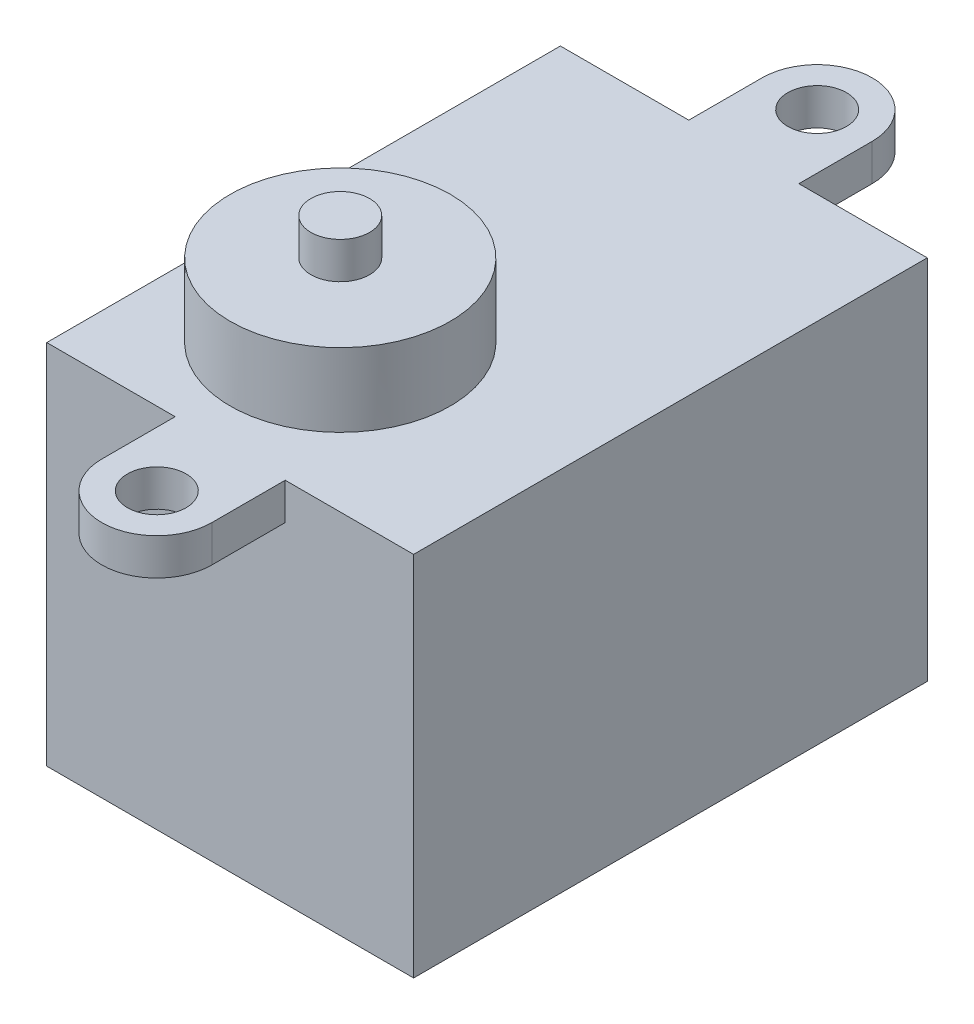
from build123d import *

# Parameters (mm, degrees)
SKETCH1_W           = 50
SKETCH1_H           = 70
BOSS_EXTRUDE1_DEPTH = 50
SKETCH2_R           = 15
BOSS_EXTRUDE2_DEPTH = 10
SKETCH3_R           = 4
BOSS_EXTRUDE3_DEPTH = 5
SHELL7_START        = 2
SHELL7_OUTLINE_W    = 46
SHELL7_OUTLINE_H    = 66
SHELL7_DEPTH        = 46
SHELL7_START_2      = 48
SHELL7_2_OUTLINE_R  = 13
SHELL7_2_DEPTH      = 10
SHELL7_START_3      = 58
SHELL7_3_OUTLINE_R  = 2
SHELL7_3_DEPTH      = 5
SKETCH4_R           = 4
BOSS_EXTRUDE4_DEPTH = 5


# Read off the part's stored shape, not the designer's step: Shell7
with BuildPart() as part:
    # Sketch1 → Boss-Extrude1 (new body)
    with BuildSketch(Plane(origin=(0, 0, 0), x_dir=(1, 0, 0), z_dir=(0, 1, 0))):
        with Locations((25, 35)):
            Rectangle(SKETCH1_W, SKETCH1_H)
    extrude(amount=BOSS_EXTRUDE1_DEPTH)

    # Sketch2 → Boss-Extrude2 (add)
    with BuildSketch(Plane(origin=(0, 50, 0), x_dir=(1, 0, 0), z_dir=(0, 1, 0))):
        with Locations(Location((20, 20, 0), (0, 0, 90))):
            Circle(SKETCH2_R)
    extrude(amount=BOSS_EXTRUDE2_DEPTH)

    # Sketch3 → Boss-Extrude3 (add)
    with BuildSketch(Plane(origin=(0, 60, 0), x_dir=(1, 0, 0), z_dir=(0, 1, 0))):
        with Locations(Location((20, 20, 0), (0, 0, 270))):
            Circle(SKETCH3_R)
    extrude(amount=BOSS_EXTRUDE3_DEPTH)

    # Shell7 outline → Shell7 (cut)
    with BuildSketch(Plane(origin=(0, 0, 0), x_dir=(1, 0, 0), z_dir=(0, 1, 0)).offset(SHELL7_START)):
        with Locations((25, 35)):
            Rectangle(SHELL7_OUTLINE_W, SHELL7_OUTLINE_H)
    extrude(amount=SHELL7_DEPTH, mode=Mode.SUBTRACT)

    # Shell7 2 outline → Shell7 2 (cut)
    with BuildSketch(Plane(origin=(0, 0, 0), x_dir=(1, 0, 0), z_dir=(0, 1, 0)).offset(SHELL7_START_2)):
        with Locations((20, 20)):
            Circle(SHELL7_2_OUTLINE_R)
    extrude(amount=SHELL7_2_DEPTH, mode=Mode.SUBTRACT)

    # Shell7 3 outline → Shell7 3 (cut)
    with BuildSketch(Plane(origin=(0, 0, 0), x_dir=(1, 0, 0), z_dir=(0, 1, 0)).offset(SHELL7_START_3)):
        with Locations((20, 20)):
            Circle(SHELL7_3_OUTLINE_R)
    extrude(amount=SHELL7_3_DEPTH, mode=Mode.SUBTRACT)

    # Sketch4 → Boss-Extrude4 (add)
    with BuildSketch(Plane(origin=(0, 50, 0), x_dir=(1, 0, 0), z_dir=(0, 1, 0))):
        with BuildLine():
            Line((17.5, 70), (32.5, 70))
            Line((32.5, 70), (32.5, 80))
            ThreePointArc((32.5, 80), (25, 87.5), (17.5, 80))
            Line((17.5, 80), (17.5, 70))
        make_face()
        with Locations(Location((25, 80, 0), (0, 0, 270))):
            Circle(SKETCH4_R, mode=Mode.SUBTRACT)
    boss_extrude4 = extrude(amount=-BOSS_EXTRUDE4_DEPTH)

    # Mirror1: Boss-Extrude4 across plane
    add(boss_extrude4.mirror(Plane(origin=(0, 0, -35), x_dir=(1, 0, 0), z_dir=(0, 0, -1))))


solid = part.part
